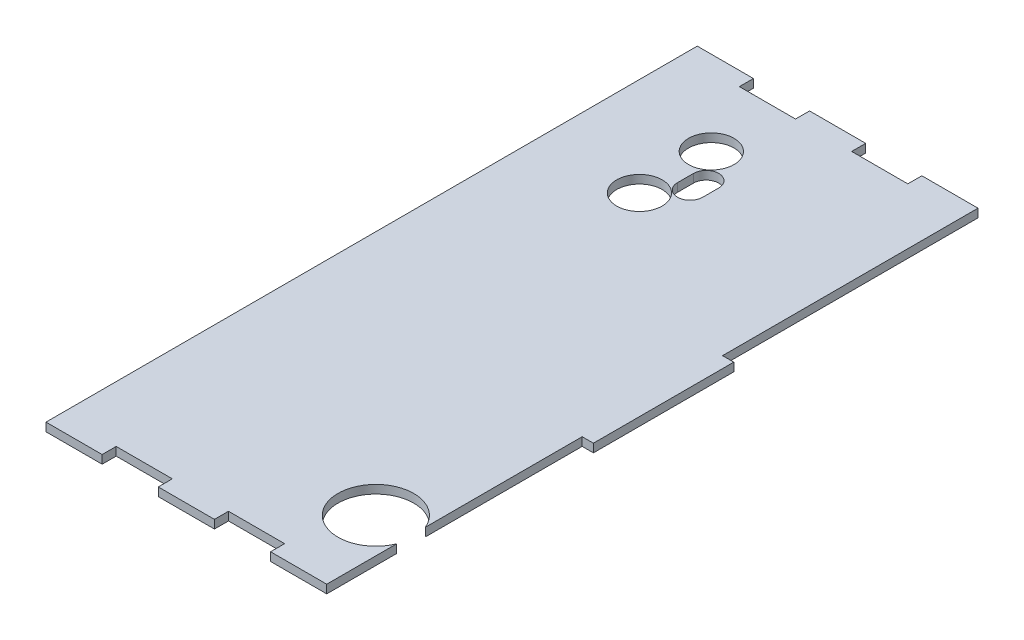
from build123d import *

# Parameters (mm, degrees)
SKETCH1_R           = 8.1
BOSS_EXTRUDE1_DEPTH = 3


with BuildPart() as part:
    # Sketch1 → Boss-Extrude1 (new body)
    with BuildSketch(Plane(origin=(0, 0, 0), x_dir=(1, 0, 0), z_dir=(0, 1, 0))):
        with BuildLine():
            Line((-50, -111), (-50, -116))
            Line((-50, -116), (-30, -116))
            Line((-30, -116), (-30, -111))
            Line((-30, -111), (-10, -111))
            Line((-10, -111), (-10, -116))
            Line((-10, -116), (10, -116))
            Line((10, -116), (10, -111))
            Line((10, -111), (30, -111))
            Line((30, -111), (30, -116))
            Line((30, -116), (50, -116))
            Line((50, -116), (50, -111))
            Line((50, -111), (50, -91.099019514))
            ThreePointArc((50, -91.099019514), (24, -86), (50, -80.900980486))
            Line((50, -80.900980486), (50, -25))
            Line((50, -25), (54, -25))
            Line((54, -25), (54, 25))
            Line((54, 25), (50, 25))
            Line((50, 25), (50, 111))
            Line((50, 111), (50, 116))
            Line((50, 116), (30, 116))
            Line((30, 116), (30, 111))
            Line((30, 111), (10, 111))
            Line((10, 111), (10, 116))
            Line((10, 116), (-10, 116))
            Line((-10, 116), (-10, 111))
            Line((-10, 111), (-30, 111))
            Line((-30, 111), (-30, 116))
            Line((-30, 116), (-50, 116))
            Line((-50, 116), (-50, 111))
            Line((-50, 111), (-50, -111))
        make_face()
        with Locations((-15, 60.4)):
            Circle(SKETCH1_R, mode=Mode.SUBTRACT)
        with Locations((-15, 86)):
            Circle(SKETCH1_R, mode=Mode.SUBTRACT)
        with BuildLine():
            Line((-11.4, 70.35), (-11.4, 76.05))
            ThreePointArc((-11.4, 76.05), (-6.9, 80.55), (-2.4, 76.05))
            Line((-2.4, 76.05), (-2.4, 70.35))
            ThreePointArc((-2.4, 70.35), (-6.9, 65.85), (-11.4, 70.35))
        make_face(mode=Mode.SUBTRACT)
    extrude(amount=BOSS_EXTRUDE1_DEPTH)


solid = part.part
